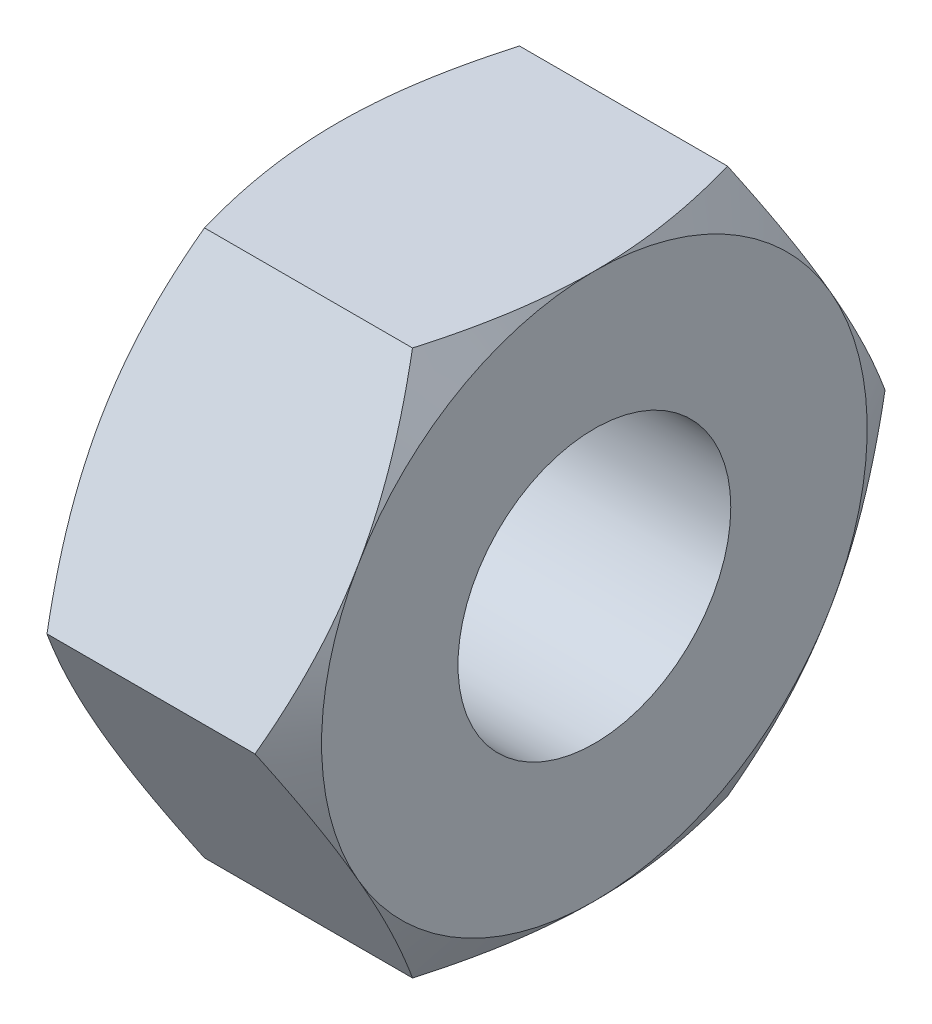
from build123d import *

# Parameters (mm, degrees)
SKETCH1_R      = 4.25
EXTRUDE1_DEPTH = 4


# Read off the part's stored shape, not the designer's step: Cut-Extrude1
with BuildPart() as part:
    # Sketch1 → Extrude1 (new, symmetric)
    with BuildSketch(Plane(origin=(0, 0, 0), x_dir=(0, 0, -1), z_dir=(1, 0, 0))):
        Polygon((9.814954576, 0), (4.907477288, 8.5), (-4.907477288, 8.5), (-9.814954576, 0), (-4.907477288, -8.5), (4.907477288, -8.5), align=None)
        Circle(SKETCH1_R, mode=Mode.SUBTRACT)
    extrude(amount=EXTRUDE1_DEPTH, both=True)

    # Cut-Extrude1 outline → Cut-Extrude1 (revolve, cut)
    with BuildSketch(Plane.YX):
        Polygon((9.81495458, 4.000000073), (8.499999937, 4.000000073), (9.81495458, 3.240810619), align=None)
    cut_extrude1 = revolve(axis=Axis((0, 0, 0), (1, 0, 0)), mode=Mode.SUBTRACT)

    # Mirror1: Cut-Extrude1 across plane
    add(cut_extrude1.mirror(Plane(origin=(0, 0, 0), x_dir=(0, 0, 1), z_dir=(1, 0, 0))), mode=Mode.SUBTRACT)


solid = part.part
